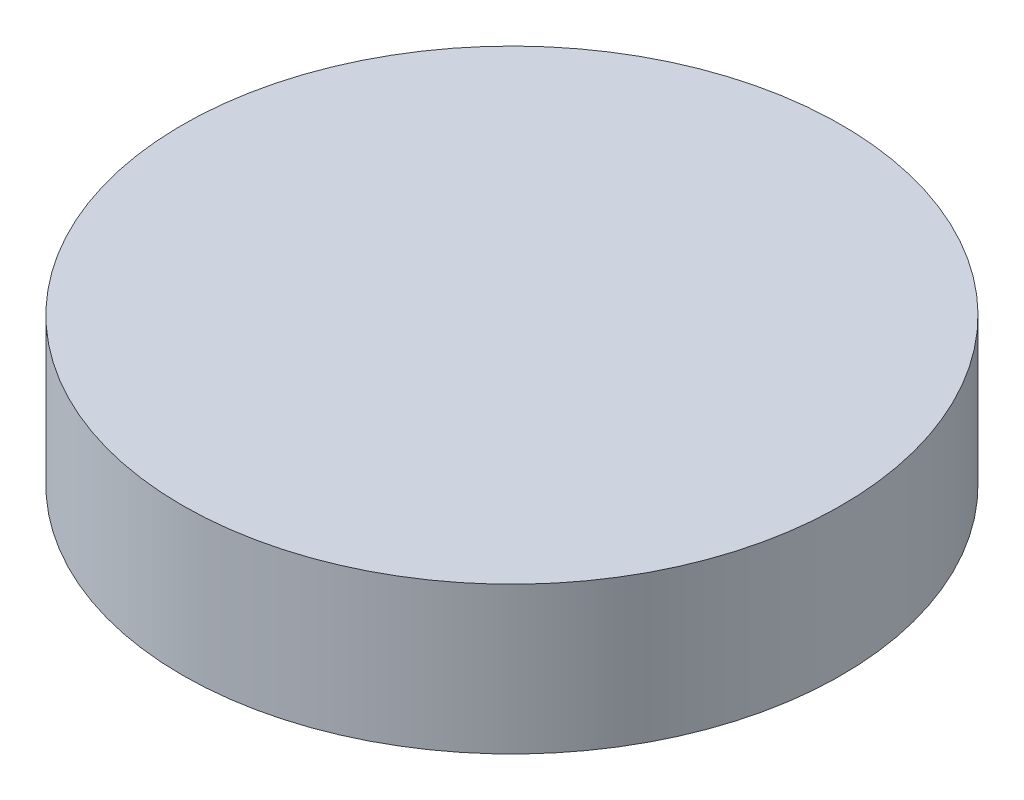
from build123d import *

# Parameters (mm, degrees)
BOSS_EXTRUDE2_OUTLINE_R   = 3.9
BOSS_EXTRUDE2_DEPTH       = 24
BOSS_EXTRUDE2_2_OUTLINE_R = 65
BOSS_EXTRUDE2_2_DEPTH     = 24
SKETCH3_R                 = 65
BOSS_EXTRUDE3_DEPTH       = 5


with BuildPart() as part:
    # Boss-Extrude2: read off the stored shape, not the designer's step
    # Boss-Extrude2 outline → Boss-Extrude2 (new body)
    with BuildSketch(Plane(origin=(0, 0, 0), x_dir=(1, 0, 0), z_dir=(0, 1, 0))):
        Circle(BOSS_EXTRUDE2_OUTLINE_R)
    extrude(amount=BOSS_EXTRUDE2_DEPTH)


with BuildPart() as body_2:
    # Boss-Extrude2 2 outline → Boss-Extrude2 2 (new body)
    with BuildSketch(Plane(origin=(0, 0, 0), x_dir=(1, 0, 0), z_dir=(0, 1, 0))):
        Circle(BOSS_EXTRUDE2_2_OUTLINE_R)
        with BuildLine():
            Line((5.271243713, -59.719306042), (3.256818553, -54.90348926))
            ThreePointArc((3.256818553, -54.90348926), (2.878477593, -54.924624411), (2.5, -54.94315244))
            Line((2.5, -54.94315244), (1, -59.94315244))
            Line((1, -59.94315244), (-1, -59.94315244))
            Line((-1, -59.94315244), (-2.5, -54.94315244))
            ThreePointArc((-2.5, -54.94315244), (-2.878477593, -54.924624412), (-3.256818553, -54.90348926))
            Line((-3.256818553, -54.90348926), (-5.271243713, -59.719306042))
            Line((-5.271243713, -59.719306042), (-7.260287503, -59.510249115))
            Line((-7.260287503, -59.510249115), (-8.22942803, -54.380846944))
            ThreePointArc((-8.22942803, -54.380846944), (-8.603895577, -54.322858733), (-8.977954721, -54.262291963))
            Line((-8.977954721, -54.262291963), (-11.484734576, -58.84116243))
            Line((-11.484734576, -58.84116243), (-13.441029777, -58.425339048))
            Line((-13.441029777, -58.425339048), (-13.868692724, -53.222733509))
            ThreePointArc((-13.868692724, -53.222733509), (-14.235047481, -53.125920446), (-14.600726538, -53.026585639))
            Line((-14.600726538, -53.026585639), (-17.572396284, -57.318342729))
            Line((-17.572396284, -57.318342729), (-19.474509316, -56.700308741))
            Line((-19.474509316, -56.700308741), (-19.356009119, -51.481500668))
            ThreePointArc((-19.356009119, -51.481500668), (-19.710237225, -51.346923457), (-20.063529739, -51.209908947))
            Line((-20.063529739, -51.209908947), (-23.467531141, -55.167531271))
            Line((-23.467531141, -55.167531271), (-25.294622056, -54.354057985))
            Line((-25.294622056, -54.354057985), (-24.631257027, -49.176225732))
            ThreePointArc((-24.631257027, -49.176225732), (-24.969477485, -49.00535883), (-25.30651271, -48.832165777))
            Line((-25.30651271, -48.832165777), (-29.105550816, -52.412292796))
            Line((-29.105550816, -52.412292796), (-30.837601624, -51.412292796))
            Line((-30.837601624, -51.412292796), (-29.636639729, -46.332165777))
            ThreePointArc((-29.636639729, -46.332165777), (-29.955146926, -46.126881237), (-30.272232232, -45.919407179))
            Line((-30.272232232, -45.919407179), (-34.424683985, -49.082814272))
            Line((-34.424683985, -49.082814272), (-36.042717974, -47.907243768))
            Line((-36.042717974, -47.907243768), (-34.317317204, -42.980480917))
            ThreePointArc((-34.317317204, -42.980480917), (-34.612621508, -42.74302788), (-34.906282843, -42.503545947))
            Line((-34.906282843, -42.503545947), (-39.366653113, -45.215574165))
            Line((-39.366653113, -45.215574165), (-40.852942764, -43.877312952))
            Line((-40.852942764, -43.877312952), (-38.622006971, -39.157892915))
            ThreePointArc((-38.622006971, -39.157892915), (-38.890872965, -38.890872965), (-39.157892915, -38.622006971))
            Line((-39.157892915, -38.622006971), (-43.877312952, -40.852942764))
            Line((-43.877312952, -40.852942764), (-45.215574165, -39.366653113))
            Line((-45.215574165, -39.366653113), (-42.503545947, -34.906282844))
            ThreePointArc((-42.503545947, -34.906282844), (-42.74302788, -34.612621508), (-42.980480917, -34.317317204))
            Line((-42.980480917, -34.317317204), (-47.907243768, -36.042717974))
            Line((-47.907243768, -36.042717974), (-49.082814272, -34.424683986))
            Line((-49.082814272, -34.424683986), (-45.919407179, -30.272232233))
            ThreePointArc((-45.919407179, -30.272232233), (-46.126881237, -29.955146926), (-46.332165777, -29.636639729))
            Line((-46.332165777, -29.636639729), (-51.412292796, -30.837601624))
            Line((-51.412292796, -30.837601624), (-52.412292796, -29.105550816))
            Line((-52.412292796, -29.105550816), (-48.832165777, -25.30651271))
            ThreePointArc((-48.832165777, -25.30651271), (-49.00535883, -24.969477485), (-49.176225732, -24.631257027))
            Line((-49.176225732, -24.631257027), (-54.354057985, -25.294622056))
            Line((-54.354057985, -25.294622056), (-55.167531271, -23.467531141))
            Line((-55.167531271, -23.467531141), (-51.209908947, -20.063529739))
            ThreePointArc((-51.209908947, -20.063529739), (-51.346923457, -19.710237225), (-51.481500668, -19.356009119))
            Line((-51.481500668, -19.356009119), (-56.700308741, -19.474509317))
            Line((-56.700308741, -19.474509317), (-57.318342729, -17.572396284))
            Line((-57.318342729, -17.572396284), (-53.026585639, -14.600726538))
            ThreePointArc((-53.026585639, -14.600726538), (-53.125920446, -14.235047481), (-53.222733508, -13.868692724))
            Line((-53.222733508, -13.868692724), (-58.425339048, -13.441029777))
            Line((-58.425339048, -13.441029777), (-58.84116243, -11.484734576))
            Line((-58.84116243, -11.484734576), (-54.262291963, -8.977954721))
            ThreePointArc((-54.262291963, -8.977954721), (-54.322858733, -8.603895577), (-54.380846944, -8.22942803))
            Line((-54.380846944, -8.22942803), (-59.510249115, -7.260287503))
            Line((-59.510249115, -7.260287503), (-59.719306042, -5.271243713))
            Line((-59.719306042, -5.271243713), (-54.90348926, -3.256818553))
            ThreePointArc((-54.90348926, -3.256818553), (-54.924624412, -2.878477593), (-54.94315244, -2.5))
            Line((-54.94315244, -2.5), (-59.94315244, -1))
            Line((-59.94315244, -1), (-59.94315244, 1))
            Line((-59.94315244, 1), (-54.94315244, 2.5))
            ThreePointArc((-54.94315244, 2.5), (-54.924624412, 2.878477593), (-54.90348926, 3.256818553))
            Line((-54.90348926, 3.256818553), (-59.719306042, 5.271243713))
            Line((-59.719306042, 5.271243713), (-59.510249115, 7.260287503))
            Line((-59.510249115, 7.260287503), (-54.380846944, 8.22942803))
            ThreePointArc((-54.380846944, 8.22942803), (-54.322858733, 8.603895577), (-54.262291963, 8.977954721))
            Line((-54.262291963, 8.977954721), (-58.84116243, 11.484734576))
            Line((-58.84116243, 11.484734576), (-58.425339048, 13.441029777))
            Line((-58.425339048, 13.441029777), (-53.222733508, 13.868692724))
            ThreePointArc((-53.222733508, 13.868692724), (-53.125920446, 14.235047481), (-53.026585639, 14.600726538))
            Line((-53.026585639, 14.600726538), (-57.318342729, 17.572396284))
            Line((-57.318342729, 17.572396284), (-56.700308741, 19.474509317))
            Line((-56.700308741, 19.474509317), (-51.481500668, 19.356009119))
            ThreePointArc((-51.481500668, 19.356009119), (-51.346923457, 19.710237225), (-51.209908947, 20.063529739))
            Line((-51.209908947, 20.063529739), (-55.167531271, 23.467531141))
            Line((-55.167531271, 23.467531141), (-54.354057985, 25.294622056))
            Line((-54.354057985, 25.294622056), (-49.176225732, 24.631257027))
            ThreePointArc((-49.176225732, 24.631257027), (-49.00535883, 24.969477485), (-48.832165777, 25.30651271))
            Line((-48.832165777, 25.30651271), (-52.412292796, 29.105550816))
            Line((-52.412292796, 29.105550816), (-51.412292796, 30.837601624))
            Line((-51.412292796, 30.837601624), (-46.332165777, 29.636639729))
            ThreePointArc((-46.332165777, 29.636639729), (-46.126881237, 29.955146926), (-45.919407179, 30.272232233))
            Line((-45.919407179, 30.272232233), (-49.082814272, 34.424683986))
            Line((-49.082814272, 34.424683986), (-47.907243768, 36.042717974))
            Line((-47.907243768, 36.042717974), (-42.980480917, 34.317317204))
            ThreePointArc((-42.980480917, 34.317317204), (-42.74302788, 34.612621508), (-42.503545947, 34.906282843))
            Line((-42.503545947, 34.906282843), (-45.215574165, 39.366653113))
            Line((-45.215574165, 39.366653113), (-43.877312952, 40.852942764))
            Line((-43.877312952, 40.852942764), (-39.157892915, 38.622006971))
            ThreePointArc((-39.157892915, 38.622006971), (-38.890872965, 38.890872965), (-38.622006971, 39.157892915))
            Line((-38.622006971, 39.157892915), (-40.852942764, 43.877312952))
            Line((-40.852942764, 43.877312952), (-39.366653113, 45.215574165))
            Line((-39.366653113, 45.215574165), (-34.906282843, 42.503545947))
            ThreePointArc((-34.906282843, 42.503545947), (-34.612621508, 42.74302788), (-34.317317204, 42.980480917))
            Line((-34.317317204, 42.980480917), (-36.042717974, 47.907243768))
            Line((-36.042717974, 47.907243768), (-34.424683986, 49.082814272))
            Line((-34.424683986, 49.082814272), (-30.272232233, 45.919407179))
            ThreePointArc((-30.272232233, 45.919407179), (-29.955146926, 46.126881237), (-29.636639729, 46.332165777))
            Line((-29.636639729, 46.332165777), (-30.837601624, 51.412292796))
            Line((-30.837601624, 51.412292796), (-29.105550816, 52.412292796))
            Line((-29.105550816, 52.412292796), (-25.30651271, 48.832165777))
            ThreePointArc((-25.30651271, 48.832165777), (-24.969477485, 49.00535883), (-24.631257027, 49.176225732))
            Line((-24.631257027, 49.176225732), (-25.294622056, 54.354057985))
            Line((-25.294622056, 54.354057985), (-23.467531141, 55.167531271))
            Line((-23.467531141, 55.167531271), (-20.063529739, 51.209908947))
            ThreePointArc((-20.063529739, 51.209908947), (-19.710237225, 51.346923457), (-19.356009119, 51.481500668))
            Line((-19.356009119, 51.481500668), (-19.474509317, 56.700308741))
            Line((-19.474509317, 56.700308741), (-17.572396284, 57.318342729))
            Line((-17.572396284, 57.318342729), (-14.600726538, 53.026585639))
            ThreePointArc((-14.600726538, 53.026585639), (-14.235047481, 53.125920446), (-13.868692724, 53.222733508))
            Line((-13.868692724, 53.222733508), (-13.441029777, 58.425339048))
            Line((-13.441029777, 58.425339048), (-11.484734576, 58.84116243))
            Line((-11.484734576, 58.84116243), (-8.977954721, 54.262291963))
            ThreePointArc((-8.977954721, 54.262291963), (-8.603895577, 54.322858733), (-8.22942803, 54.380846944))
            Line((-8.22942803, 54.380846944), (-7.260287503, 59.510249115))
            Line((-7.260287503, 59.510249115), (-5.271243713, 59.719306042))
            Line((-5.271243713, 59.719306042), (-3.256818553, 54.90348926))
            ThreePointArc((-3.256818553, 54.90348926), (-2.878477593, 54.924624412), (-2.5, 54.94315244))
            Line((-2.5, 54.94315244), (-1, 59.94315244))
            Line((-1, 59.94315244), (1, 59.94315244))
            Line((1, 59.94315244), (2.5, 54.94315244))
            ThreePointArc((2.5, 54.94315244), (2.878477593, 54.924624412), (3.256818553, 54.90348926))
            Line((3.256818553, 54.90348926), (5.271243713, 59.719306042))
            Line((5.271243713, 59.719306042), (7.260287503, 59.510249115))
            Line((7.260287503, 59.510249115), (8.22942803, 54.380846944))
            ThreePointArc((8.22942803, 54.380846944), (8.603895577, 54.322858733), (8.977954721, 54.262291963))
            Line((8.977954721, 54.262291963), (11.484734576, 58.84116243))
            Line((11.484734576, 58.84116243), (13.441029777, 58.425339048))
            Line((13.441029777, 58.425339048), (13.868692724, 53.222733508))
            ThreePointArc((13.868692724, 53.222733508), (14.235047481, 53.125920446), (14.600726538, 53.026585639))
            Line((14.600726538, 53.026585639), (17.572396284, 57.318342729))
            Line((17.572396284, 57.318342729), (19.474509317, 56.700308741))
            Line((19.474509317, 56.700308741), (19.356009119, 51.481500668))
            ThreePointArc((19.356009119, 51.481500668), (19.710237225, 51.346923457), (20.063529739, 51.209908947))
            Line((20.063529739, 51.209908947), (23.467531141, 55.167531271))
            Line((23.467531141, 55.167531271), (25.294622056, 54.354057985))
            Line((25.294622056, 54.354057985), (24.631257027, 49.176225732))
            ThreePointArc((24.631257027, 49.176225732), (24.969477485, 49.00535883), (25.30651271, 48.832165777))
            Line((25.30651271, 48.832165777), (29.105550816, 52.412292796))
            Line((29.105550816, 52.412292796), (30.837601624, 51.412292796))
            Line((30.837601624, 51.412292796), (29.636639729, 46.332165777))
            ThreePointArc((29.636639729, 46.332165777), (29.955146926, 46.126881237), (30.272232233, 45.919407179))
            Line((30.272232233, 45.919407179), (34.424683986, 49.082814272))
            Line((34.424683986, 49.082814272), (36.042717974, 47.907243768))
            Line((36.042717974, 47.907243768), (34.317317204, 42.980480917))
            ThreePointArc((34.317317204, 42.980480917), (34.612621508, 42.74302788), (34.906282843, 42.503545947))
            Line((34.906282843, 42.503545947), (39.366653113, 45.215574165))
            Line((39.366653113, 45.215574165), (40.852942764, 43.877312952))
            Line((40.852942764, 43.877312952), (38.622006971, 39.157892915))
            ThreePointArc((38.622006971, 39.157892915), (38.890872965, 38.890872965), (39.157892915, 38.622006971))
            Line((39.157892915, 38.622006971), (43.877312952, 40.852942764))
            Line((43.877312952, 40.852942764), (45.215574165, 39.366653114))
            Line((45.215574165, 39.366653114), (42.503545947, 34.906282843))
            ThreePointArc((42.503545947, 34.906282843), (42.74302788, 34.612621508), (42.980480917, 34.317317204))
            Line((42.980480917, 34.317317204), (47.907243768, 36.042717974))
            Line((47.907243768, 36.042717974), (49.082814272, 34.424683986))
            Line((49.082814272, 34.424683986), (45.919407179, 30.272232233))
            ThreePointArc((45.919407179, 30.272232233), (46.126881237, 29.955146926), (46.332165777, 29.636639729))
            Line((46.332165777, 29.636639729), (51.412292796, 30.837601624))
            Line((51.412292796, 30.837601624), (52.412292796, 29.105550816))
            Line((52.412292796, 29.105550816), (48.832165777, 25.30651271))
            ThreePointArc((48.832165777, 25.30651271), (49.00535883, 24.969477485), (49.176225732, 24.631257027))
            Line((49.176225732, 24.631257027), (54.354057985, 25.294622056))
            Line((54.354057985, 25.294622056), (55.167531271, 23.467531141))
            Line((55.167531271, 23.467531141), (51.209908947, 20.063529739))
            ThreePointArc((51.209908947, 20.063529739), (51.346923457, 19.710237225), (51.481500668, 19.356009119))
            Line((51.481500668, 19.356009119), (56.700308741, 19.474509317))
            Line((56.700308741, 19.474509317), (57.318342729, 17.572396284))
            Line((57.318342729, 17.572396284), (53.026585639, 14.600726538))
            ThreePointArc((53.026585639, 14.600726538), (53.125920446, 14.235047481), (53.222733508, 13.868692724))
            Line((53.222733508, 13.868692724), (58.425339048, 13.441029777))
            Line((58.425339048, 13.441029777), (58.84116243, 11.484734576))
            Line((58.84116243, 11.484734576), (54.262291963, 8.977954721))
            ThreePointArc((54.262291963, 8.977954721), (54.322858733, 8.603895577), (54.380846944, 8.22942803))
            Line((54.380846944, 8.22942803), (59.510249115, 7.260287503))
            Line((59.510249115, 7.260287503), (59.719306042, 5.271243713))
            Line((59.719306042, 5.271243713), (54.90348926, 3.256818553))
            ThreePointArc((54.90348926, 3.256818553), (54.924624412, 2.878477593), (54.94315244, 2.5))
            Line((54.94315244, 2.5), (59.94315244, 1))
            Line((59.94315244, 1), (59.94315244, -1))
            Line((59.94315244, -1), (54.94315244, -2.5))
            ThreePointArc((54.94315244, -2.5), (54.924624412, -2.878477593), (54.90348926, -3.256818553))
            Line((54.90348926, -3.256818553), (59.719306042, -5.271243713))
            Line((59.719306042, -5.271243713), (59.510249115, -7.260287503))
            Line((59.510249115, -7.260287503), (54.380846944, -8.22942803))
            ThreePointArc((54.380846944, -8.22942803), (54.322858733, -8.603895577), (54.262291963, -8.977954721))
            Line((54.262291963, -8.977954721), (58.84116243, -11.484734576))
            Line((58.84116243, -11.484734576), (58.425339048, -13.441029777))
            Line((58.425339048, -13.441029777), (53.222733508, -13.868692724))
            ThreePointArc((53.222733508, -13.868692724), (53.125920446, -14.235047481), (53.026585639, -14.600726538))
            Line((53.026585639, -14.600726538), (57.318342729, -17.572396284))
            Line((57.318342729, -17.572396284), (56.700308741, -19.474509317))
            Line((56.700308741, -19.474509317), (51.481500668, -19.356009119))
            ThreePointArc((51.481500668, -19.356009119), (51.346923457, -19.710237225), (51.209908947, -20.063529739))
            Line((51.209908947, -20.063529739), (55.167531271, -23.467531141))
            Line((55.167531271, -23.467531141), (54.354057985, -25.294622056))
            Line((54.354057985, -25.294622056), (49.176225732, -24.631257027))
            ThreePointArc((49.176225732, -24.631257027), (49.00535883, -24.969477485), (48.832165777, -25.30651271))
            Line((48.832165777, -25.30651271), (52.412292796, -29.105550816))
            Line((52.412292796, -29.105550816), (51.412292796, -30.837601624))
            Line((51.412292796, -30.837601624), (46.332165777, -29.636639729))
            ThreePointArc((46.332165777, -29.636639729), (46.126881237, -29.955146926), (45.919407179, -30.272232232))
            Line((45.919407179, -30.272232232), (49.082814272, -34.424683986))
            Line((49.082814272, -34.424683986), (47.907243768, -36.042717974))
            Line((47.907243768, -36.042717974), (42.980480917, -34.317317204))
            ThreePointArc((42.980480917, -34.317317204), (42.74302788, -34.612621508), (42.503545947, -34.906282843))
            Line((42.503545947, -34.906282843), (45.215574165, -39.366653113))
            Line((45.215574165, -39.366653113), (43.877312952, -40.852942764))
            Line((43.877312952, -40.852942764), (39.157892915, -38.622006971))
            ThreePointArc((39.157892915, -38.622006971), (38.890872965, -38.890872965), (38.622006971, -39.157892915))
            Line((38.622006971, -39.157892915), (40.852942764, -43.877312952))
            Line((40.852942764, -43.877312952), (39.366653114, -45.215574165))
            Line((39.366653114, -45.215574165), (34.906282844, -42.503545947))
            ThreePointArc((34.906282844, -42.503545947), (34.612621508, -42.74302788), (34.317317204, -42.980480917))
            Line((34.317317204, -42.980480917), (36.042717974, -47.907243768))
            Line((36.042717974, -47.907243768), (34.424683986, -49.082814272))
            Line((34.424683986, -49.082814272), (30.272232233, -45.919407179))
            ThreePointArc((30.272232233, -45.919407179), (29.955146926, -46.126881237), (29.636639729, -46.332165777))
            Line((29.636639729, -46.332165777), (30.837601624, -51.412292796))
            Line((30.837601624, -51.412292796), (29.105550816, -52.412292796))
            Line((29.105550816, -52.412292796), (25.30651271, -48.832165777))
            ThreePointArc((25.30651271, -48.832165777), (24.969477485, -49.00535883), (24.631257027, -49.176225732))
            Line((24.631257027, -49.176225732), (25.294622056, -54.354057985))
            Line((25.294622056, -54.354057985), (23.467531141, -55.167531271))
            Line((23.467531141, -55.167531271), (20.063529739, -51.209908947))
            ThreePointArc((20.063529739, -51.209908947), (19.710237225, -51.346923457), (19.356009119, -51.481500668))
            Line((19.356009119, -51.481500668), (19.474509317, -56.700308741))
            Line((19.474509317, -56.700308741), (17.572396284, -57.318342729))
            Line((17.572396284, -57.318342729), (14.600726538, -53.026585639))
            ThreePointArc((14.600726538, -53.026585639), (14.235047481, -53.125920446), (13.868692724, -53.222733508))
            Line((13.868692724, -53.222733508), (13.441029777, -58.425339048))
            Line((13.441029777, -58.425339048), (11.484734576, -58.84116243))
            Line((11.484734576, -58.84116243), (8.977954721, -54.262291963))
            ThreePointArc((8.977954721, -54.262291963), (8.603895577, -54.322858733), (8.22942803, -54.380846944))
            Line((8.22942803, -54.380846944), (7.260287503, -59.510249115))
            Line((7.260287503, -59.510249115), (5.271243713, -59.719306042))
        make_face(mode=Mode.SUBTRACT)
    extrude(amount=BOSS_EXTRUDE2_2_DEPTH)

    # Sketch3 → Boss-Extrude3 (add)
    with BuildSketch(Plane(origin=(0, 24, 0), x_dir=(1, 0, 0), z_dir=(0, 1, 0))):
        with Locations(Location((0, 0, 0), (0, 0, 270))):
            Circle(SKETCH3_R)
    extrude(amount=BOSS_EXTRUDE3_DEPTH)


solid = Compound([part.part, body_2.part])
